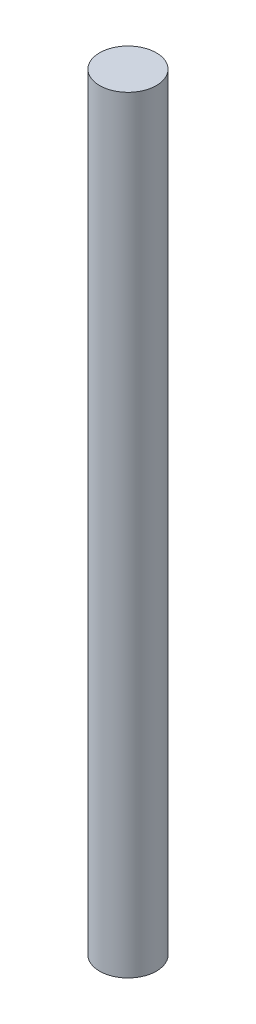
from build123d import *

# Parameters (mm, degrees)
SKETCH1_R           = 1.4732
BOSS_EXTRUDE1_DEPTH = 39.8272


with BuildPart() as part:
    # Sketch1 → Boss-Extrude1 (new body)
    with BuildSketch(Plane(origin=(0, 0, 0), x_dir=(1, 0, 0), z_dir=(0, 1, 0))):
        Circle(SKETCH1_R)
    extrude(amount=BOSS_EXTRUDE1_DEPTH)


solid = part.part
